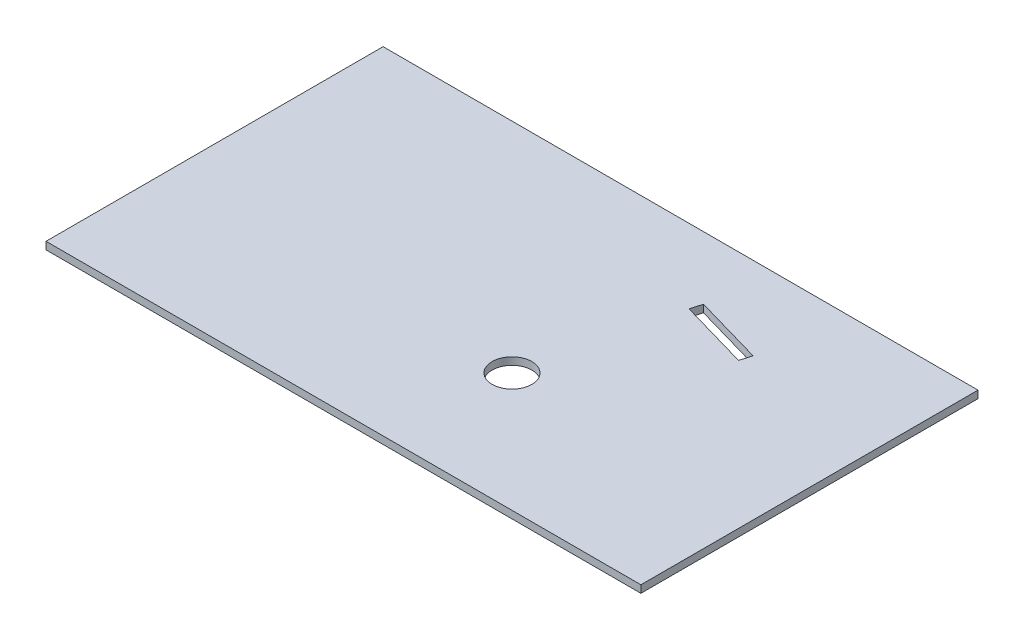
from build123d import *

# Parameters (mm, degrees)
BOSS_EXTRUDE1_DEPTH    = 50.8
SKETCH4_W              = 1524
SKETCH4_H              = 863.6
BOSS_EXTRUDE2_DEPTH    = 19.05
F_20_0MM_DOWEL_HOLE1_D = 101.6
SKETCH8_W              = 1.5875
SKETCH8_H              = 50.8
BOSS_EXTRUDE3_DEPTH    = 204
CUT_EXTRUDE1_DEPTH     = 1052.265465998


with BuildPart() as part:
    # Sketch3 → Boss-Extrude1 (new body)
    with BuildSketch(Plane(origin=(0, 0, 0), x_dir=(1, 0, 0), z_dir=(0, 1, 0))):
        with BuildLine():
            Line((-524, 0), (-525.5875, 0))
            ThreePointArc((-525.5875, 0), (-255.243310314, 459.448661655), (277.677694458, 446.248045549))
            Line((277.677694458, 446.248045549), (277.677694458, 444.377202386))
            ThreePointArc((277.677694458, 444.377202386), (-254.040241009, 458.300726541), (-524, 0))
        make_face()
    extrude(amount=BOSS_EXTRUDE1_DEPTH)

    # Sketch4 → Boss-Extrude2 (add)
    with BuildSketch(Plane(origin=(0, 50.8, 0), x_dir=(1, 0, 0), z_dir=(0, 1, 0))):
        with Locations((-127, 127)):
            Rectangle(SKETCH4_W, SKETCH4_H)
    extrude(amount=BOSS_EXTRUDE2_DEPTH)

    # Ø20.0mm Dowel Hole1 (through all)
    with Locations(Plane(origin=(0, 50.8, 0), x_dir=(-1, 0, 0), z_dir=(0, -1, 0))):
        with Locations((0, 0)):
            Hole(F_20_0MM_DOWEL_HOLE1_D / 2)

    # Sketch8 → Boss-Extrude3 (add)
    with BuildSketch(Plane.XY):
        with Locations((-524.79375, 25.4)):
            Rectangle(SKETCH8_W, SKETCH8_H)
    extrude(amount=BOSS_EXTRUDE3_DEPTH)

    # Sketch9 → Cut-Extrude1 (cut, through all)
    with BuildSketch(Plane(origin=(0, 50.8, 0), x_dir=(-1, 0, 0), z_dir=(0, -1, 0))):
        Polygon((-92.817706926, 397.838761704), (-270.651120675, 346.845850878), (-262.382, 318.008), (-84.548586251, 369.000910826), align=None)
    extrude(amount=-CUT_EXTRUDE1_DEPTH, mode=Mode.SUBTRACT)


solid = part.part
